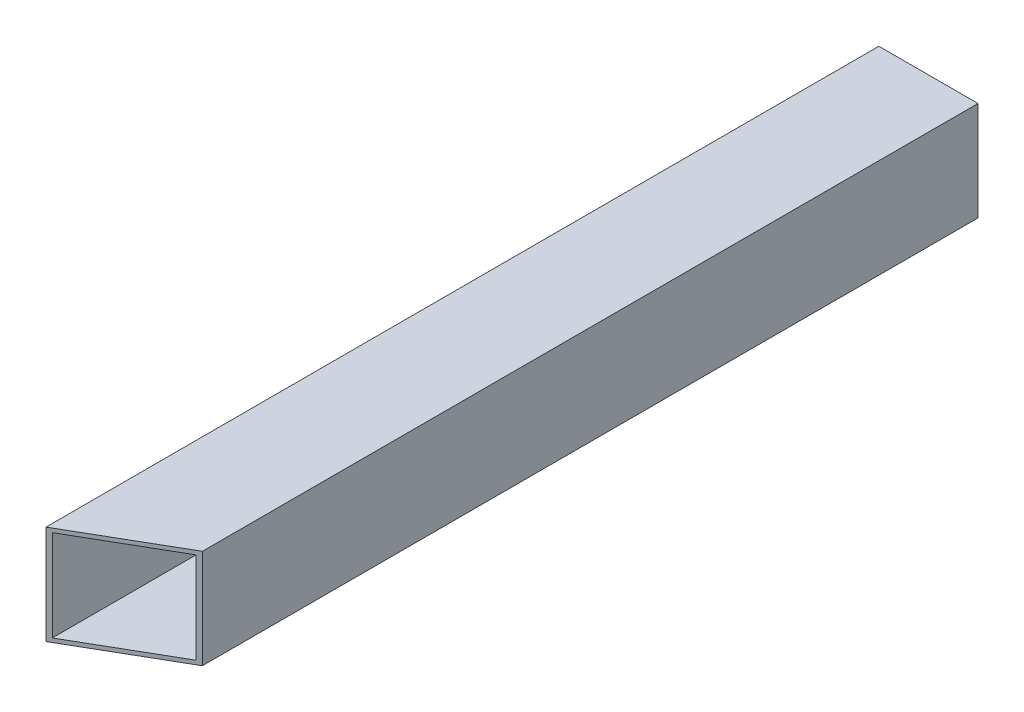
from build123d import *

# Parameters (mm, degrees)
SKETCH2_W           = 25
SKETCH2_H           = 25
SKETCH2_W_2         = 23
SKETCH2_H_2         = 23
BOSS_EXTRUDE1_DEPTH = 210
CUT_EXTRUDE1_DEPTH  = 210


with BuildPart() as part:
    # Sketch2 → Boss-Extrude1 (new body)
    with BuildSketch(Plane.XY):
        Rectangle(SKETCH2_W, SKETCH2_H)
        Rectangle(SKETCH2_W_2, SKETCH2_H_2, mode=Mode.SUBTRACT)
    extrude(amount=BOSS_EXTRUDE1_DEPTH)

    # Sketch3 → Cut-Extrude1 (cut)
    with BuildSketch(Plane(origin=(0, 12.5, 0), x_dir=(1, 0, 0), z_dir=(0, 1, 0))):
        Polygon((12.5, -210), (12.5, -195.56624327), (-12.5, -210), align=None)
    extrude(amount=-CUT_EXTRUDE1_DEPTH, mode=Mode.SUBTRACT)


solid = part.part
